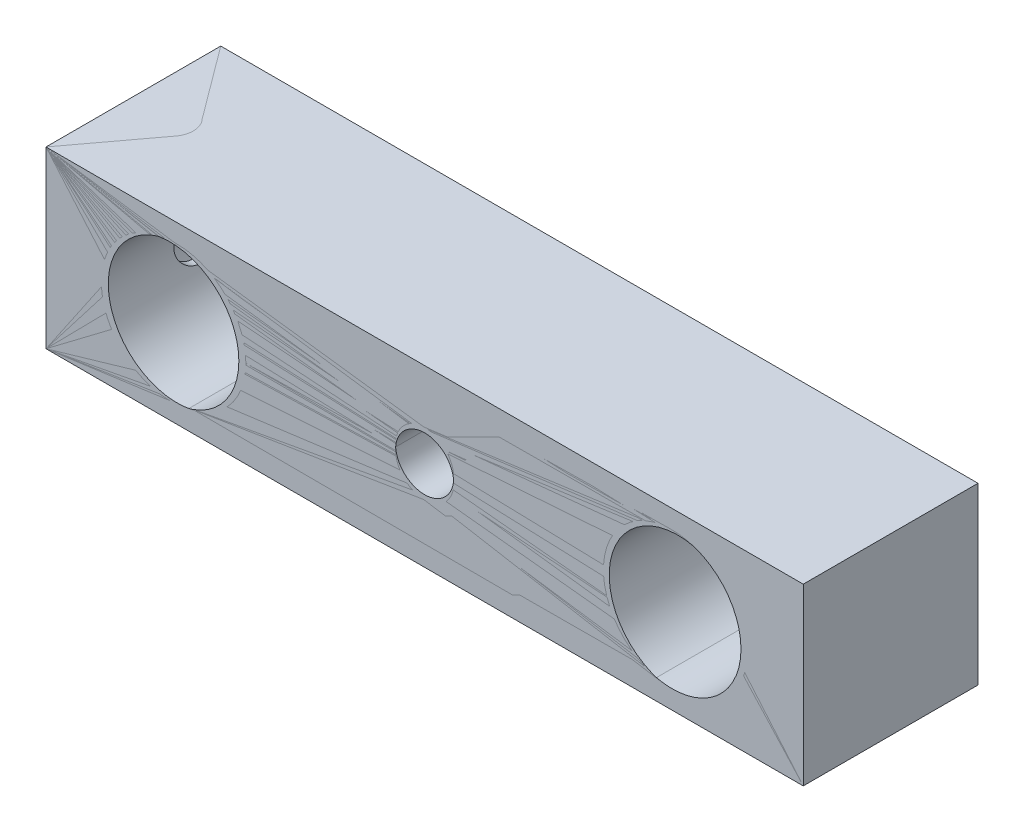
from build123d import *

# Parameters (mm, degrees)
BOSS_EXTRUDE1_OUTLINE_W     = 82.55
BOSS_EXTRUDE1_OUTLINE_H     = 19.05
BOSS_EXTRUDE1_DEPTH         = 19.05
BOSS_EXTRUDE1_START         = -9.525
BOSS_EXTRUDE1_2_OUTLINE_W   = 82.55
BOSS_EXTRUDE1_2_OUTLINE_H   = 19.05
BOSS_EXTRUDE1_2_OUTLINE_R   = 1.5875
BOSS_EXTRUDE1_2_DEPTH       = 19.05
BOSS_EXTRUDE1_START_2       = -3.175
BOSS_EXTRUDE1_3_OUTLINE_R   = 1.5875
BOSS_EXTRUDE1_3_DEPTH       = 12.7
BOSS_EXTRUDE1_4_OUTLINE_R   = 3.175
BOSS_EXTRUDE1_4_OUTLINE_R_2 = 7.5
BOSS_EXTRUDE1_4_DEPTH       = 19.05
BOSS_EXTRUDE1_START_3       = 34
BOSS_EXTRUDE1_5_OUTLINE_R   = 1.5875
BOSS_EXTRUDE1_5_DEPTH       = 7.275
SKETCH2_R                   = 3.175
CUT_EXTRUDE1_DEPTH          = 47.446245962
SKETCH4_R                   = 7.5
CUT_EXTRUDE3_DEPTH          = 47.446245962
SKETCH29_R                  = 2.38125
CUT_EXTRUDE5_DEPTH          = 5.08
CUT_EXTRUDE7_REACH          = 87.253
CUT_EXTRUDE7_END_RADIUS     = 7.5
SKETCH51_R                  = 2.38125


with BuildPart() as part:
    # Boss-Extrude1: read off the stored shape, not the designer's step
    # Boss-Extrude1 outline → Boss-Extrude1 (new body)
    with BuildSketch(Plane.XY):
        Rectangle(BOSS_EXTRUDE1_OUTLINE_W, BOSS_EXTRUDE1_OUTLINE_H)
    extrude(amount=BOSS_EXTRUDE1_DEPTH)

    # Sketch2 → Cut-Extrude1 (cut, through all)
    with BuildSketch(Plane.XY.offset(19.05)):
        with Locations((0, 0.508)):
            Circle(SKETCH2_R)
    extrude(amount=-CUT_EXTRUDE1_DEPTH, mode=Mode.SUBTRACT)

    # Sketch4 → Cut-Extrude3 (cut, through all)
    with BuildSketch(Plane.XY.offset(19.05)):
        with Locations((-26.9875, 0)):
            Circle(SKETCH4_R)
        with Locations((26.9875, 0)):
            Circle(SKETCH4_R)
    extrude(amount=-CUT_EXTRUDE3_DEPTH, mode=Mode.SUBTRACT)

    # Sketch29 → Cut-Extrude5 (cut)
    with BuildSketch(Plane(origin=(0, 9.525, 0), x_dir=(1, 0, 0), z_dir=(0, 1, 0))):
        with Locations(Location((-37.1348, -9.525, 0), (0, 0, 270))):
            Circle(SKETCH29_R)
    extrude(amount=-CUT_EXTRUDE5_DEPTH, mode=Mode.SUBTRACT)

    # Cut-Extrude7: up to this cylinder (the profile starts outside it)
    cut_extrude7_end = Plane(origin=(-26.9875, 0, 9.525), z_dir=(0, 0, 1)) * Cylinder(CUT_EXTRUDE7_END_RADIUS, 190.506, mode=Mode.PRIVATE)
    # Sketch51 → Cut-Extrude7 (cut, up to the surface)
    with BuildSketch(Plane.ZY.offset(41.275), mode=Mode.PRIVATE) as cut_extrude7_sk1:
        with Locations(Location((9.525, -0.2286, 0), (0, 0, 270))):
            Circle(SKETCH51_R)
    cut_extrude7_tool1 = extrude(cut_extrude7_sk1.sketch, amount=-CUT_EXTRUDE7_REACH, mode=Mode.PRIVATE) - cut_extrude7_end
    add(cut_extrude7_tool1.solids().sort_by_distance((-41.275, -0.2286, 9.525))[0], mode=Mode.SUBTRACT)


with BuildPart() as body_2:
    # Boss-Extrude1 2 outline → Boss-Extrude1 2 (new body)
    with BuildSketch(Plane(origin=(0, 0, 0), x_dir=(1, 0, 0), z_dir=(0, 1, 0)).offset(BOSS_EXTRUDE1_START)):
        with Locations((0, -9.525)):
            Rectangle(BOSS_EXTRUDE1_2_OUTLINE_W, BOSS_EXTRUDE1_2_OUTLINE_H)
        with Locations((-38.66896, -9.525)):
            Circle(BOSS_EXTRUDE1_2_OUTLINE_R, mode=Mode.SUBTRACT)
        with Locations((29.21, -9.525)):
            Circle(BOSS_EXTRUDE1_2_OUTLINE_R, mode=Mode.SUBTRACT)
        with Locations((38.66896, -9.525)):
            Circle(BOSS_EXTRUDE1_2_OUTLINE_R, mode=Mode.SUBTRACT)
    extrude(amount=BOSS_EXTRUDE1_2_DEPTH)

    # Boss-Extrude1 3 outline → Boss-Extrude1 3 (add)
    with BuildSketch(Plane(origin=(0, 0, 0), x_dir=(1, 0, 0), z_dir=(0, 1, 0)).offset(BOSS_EXTRUDE1_START_2)):
        with Locations((38.66896, -9.525)):
            Circle(BOSS_EXTRUDE1_3_OUTLINE_R)
        with Locations((-38.66896, -9.525)):
            Circle(BOSS_EXTRUDE1_3_OUTLINE_R)
    extrude(amount=BOSS_EXTRUDE1_3_DEPTH)

    # Boss-Extrude1 4 outline → Boss-Extrude1 4 (cut)
    with BuildSketch(Plane.XY):
        Circle(BOSS_EXTRUDE1_4_OUTLINE_R)
        with Locations((27.619999315, -0.176721762)):
            Circle(BOSS_EXTRUDE1_4_OUTLINE_R_2)
        with Locations((-27.752000685, -0.176721762)):
            Circle(BOSS_EXTRUDE1_4_OUTLINE_R_2)
    extrude(amount=BOSS_EXTRUDE1_4_DEPTH, mode=Mode.SUBTRACT)

    # Boss-Extrude1 5 outline → Boss-Extrude1 5 (cut)
    with BuildSketch(Plane.YZ.offset(BOSS_EXTRUDE1_START_3)):
        with Locations((0, 9.525)):
            Circle(BOSS_EXTRUDE1_5_OUTLINE_R)
    extrude(amount=BOSS_EXTRUDE1_5_DEPTH, mode=Mode.SUBTRACT)


solid = Compound([part.part, body_2.part])
